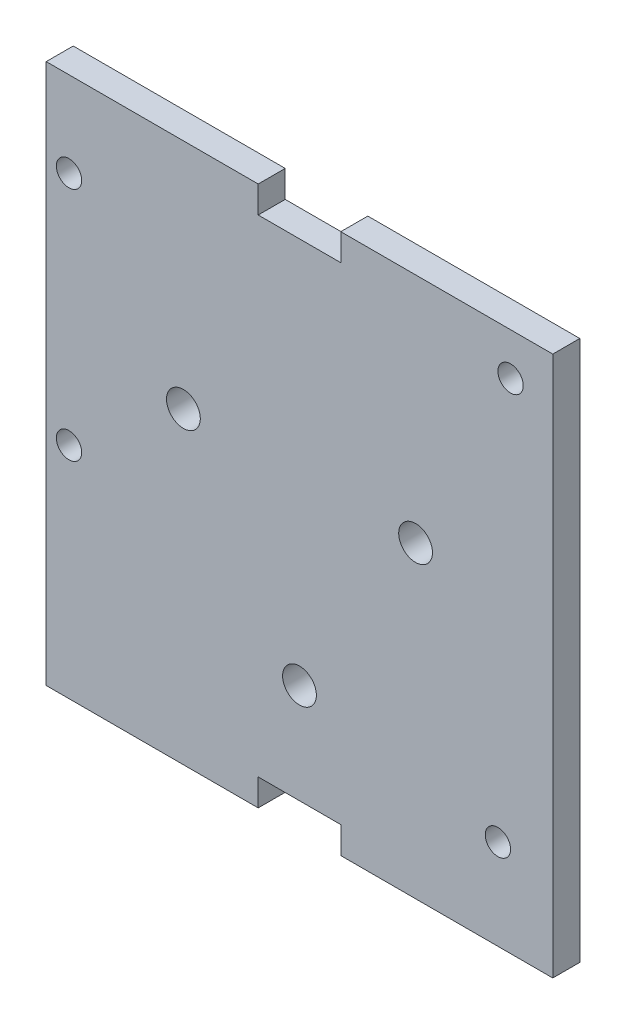
from build123d import *

# Parameters (mm, degrees)
SKETCH2_W           = 60
SKETCH2_H           = 64
TOP_DEPTH           = 3.2
SKETCH3_R           = 1.5
ARDUINO_HOLES_DEPTH = 3.2
SKETCH5_R           = 2
BATTERY_CUT_DEPTH   = 3.2
SKETCH7_W           = 9.78
SKETCH7_H           = 3.18
FRICTION_FIT_DEPTH  = 10


with BuildPart() as part:
    # Sketch2 → Top (new body)
    with BuildSketch(Plane.XY):
        with Locations((-2.549375328, 23.639166253)):
            Rectangle(SKETCH2_W, SKETCH2_H)
    extrude(amount=TOP_DEPTH)

    # Sketch3 → Arduino Holes (cut)
    with BuildSketch(Plane.XY.offset(3.2)):
        with Locations((20.950624672, 2.339166253)):
            Circle(SKETCH3_R)
        with Locations((22.450624672, 50.639166253)):
            Circle(SKETCH3_R)
        with Locations((-29.849375328, 17.639166253)):
            Circle(SKETCH3_R)
        with Locations((-29.849375328, 45.539166253)):
            Circle(SKETCH3_R)
    extrude(amount=-ARDUINO_HOLES_DEPTH, mode=Mode.SUBTRACT)

    # Sketch5 → Battery Cut (cut)
    with BuildSketch(Plane(origin=(0, 0, 0), x_dir=(-1, 0, 0), z_dir=(0, 0, -1))):
        with Locations((2.549375328, 6.639166253)):
            Circle(SKETCH5_R)
        with Locations((-11.200624672, 28.139166253)):
            Circle(SKETCH5_R)
        with Locations((16.299375328, 28.139166253)):
            Circle(SKETCH5_R)
    extrude(amount=-BATTERY_CUT_DEPTH, mode=Mode.SUBTRACT)

    # Sketch7 → Friction Fit (cut)
    with BuildSketch(Plane(origin=(0, 0, 0), x_dir=(-1, 0, 0), z_dir=(0, 0, -1))):
        with Locations((2.549375328, 54.049166253)):
            Rectangle(SKETCH7_W, SKETCH7_H)
        with Locations((2.549375328, -6.770833747)):
            Rectangle(SKETCH7_W, SKETCH7_H)
    extrude(amount=-FRICTION_FIT_DEPTH, mode=Mode.SUBTRACT)


solid = part.part
